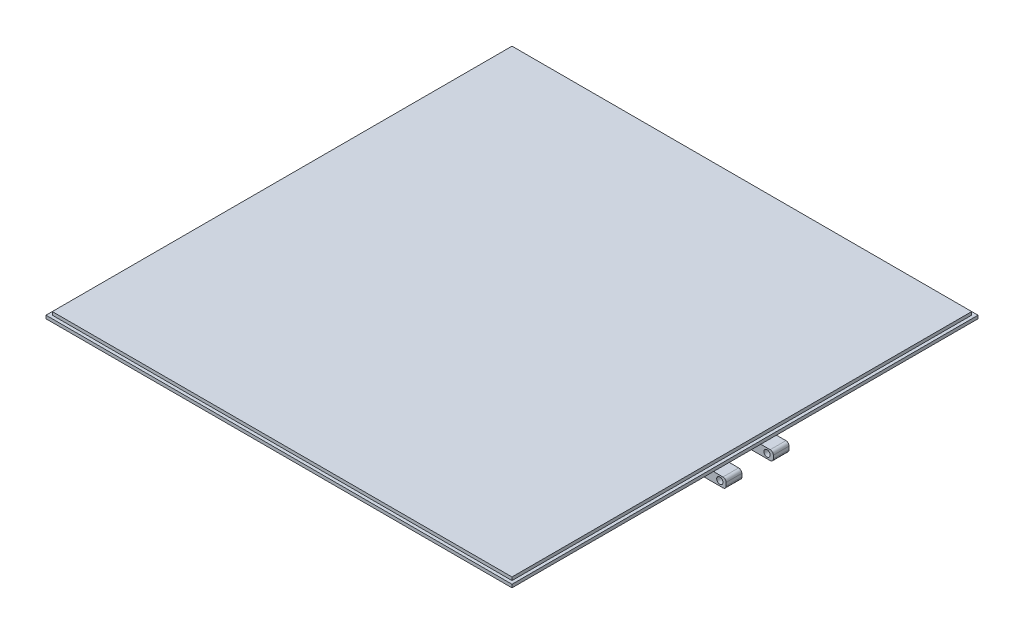
from build123d import *

# Parameters (mm, degrees)
SKETCH1_R           = 10
SKETCH1_R_2         = 7.5
BOSS_EXTRUDE1_DEPTH = 25
THREAD1_PITCH       = 0.3175
SKETCH4_W           = 146
SKETCH4_H           = 146
BOSS_EXTRUDE2_DEPTH = 2
SKETCH5_W           = 148
SKETCH5_H           = 148
BOSS_EXTRUDE3_DEPTH = 1
BOSS_EXTRUDE4_START = 7.5
SKETCH6_W           = 10
SKETCH6_H           = 3
SKETCH6_R           = 1
BOSS_EXTRUDE4_DEPTH = 2.5
BOSS_EXTRUDE5_START = -7.5
SKETCH6_2_W         = 10
SKETCH6_2_H         = 3
SKETCH6_2_R         = 1
BOSS_EXTRUDE5_DEPTH = 2.5
SKETCH9_R           = 18.995637602
CUT_EXTRUDE1_DEPTH  = 111.385687501
CHAMFER1_SIZE       = 3
FILLET1_R           = 1


with BuildPart() as part:
    # Sketch1 → Boss-Extrude1 (new body)
    with BuildSketch(Plane(origin=(0, 0, 0), x_dir=(1, 0, 0), z_dir=(0, 1, 0))):
        with Locations(Location((0, 0, 0), (0, 0, 270))):
            Circle(SKETCH1_R)
        with Locations(Location((0, 0, 0), (0, 0, 270))):
            Circle(SKETCH1_R_2, mode=Mode.SUBTRACT)
    extrude(amount=BOSS_EXTRUDE1_DEPTH)

    # Thread1: the profile of Thread Profile1 profile screwed along a right-hand helix of 18.897638 turns, 6 arcs to a turn; built about Z, then put on its axis
    thread1_z = Axis((0, 0, 0), (0, 0, 1))
    thread1_corners = [(10.0003, 0, -0.000173205), (10.0003, 0, 0.277985704), (9.828148085, 0, 0.17859375), (9.828148085, 0, 0.09921875)]
    with BuildLine(mode=Mode.PRIVATE) as thread1_profile:
        Line(thread1_corners[0], thread1_corners[1])
        Line(thread1_corners[1], thread1_corners[2])
        Line(thread1_corners[2], thread1_corners[3])
        Line(thread1_corners[3], thread1_corners[0])
    thread1_cap = Face(thread1_profile.wire())
    thread1_turn_angles = [0, 30, 60, 90, 120, 150, 180, 210, 240, 270, 300, 330, 360]
    thread1_turn_weights = [1, 0.8660254037844387, 1, 0.8660254037844387, 1, 0.8660254037844387, 1, 0.8660254037844387, 1, 0.8660254037844387, 1, 0.8660254037844387, 1]
    thread1_turn_rails = [Edge.make_bspline([Vector(p[0], p[1], 0).rotate(thread1_z, thread1_turn_angles[k]) / thread1_turn_weights[k] + Vector(0, 0, p[2] + THREAD1_PITCH * thread1_turn_angles[k] / 360) for k in range(13)], [0, 0, 0, 1, 1, 2, 2, 3, 3, 4, 4, 5, 5, 6, 6, 6], 2, thread1_turn_weights) for p in thread1_corners]
    thread1_turn_sides = [Face.make_surface_from_curves(thread1_turn_rails[p[0]], thread1_turn_rails[p[1]]) for p in [(0, 1), (1, 2), (2, 3), (3, 0)]]
    thread1_last_angles = [6480, 6510, 6540, 6570, 6600, 6630, 6660, 6690, 6720, 6750, 6780, 6791.57480315, 6803.149606299]
    thread1_last_weights = [1, 0.8660254037844387, 1, 0.8660254037844387, 1, 0.8660254037844387, 1, 0.8660254037844387, 1, 0.8660254037844387, 1, 0.9796635825089068, 1]
    thread1_last_rails = [Edge.make_bspline([Vector(p[0], p[1], 0).rotate(thread1_z, thread1_last_angles[k]) / thread1_last_weights[k] + Vector(0, 0, p[2] + THREAD1_PITCH * thread1_last_angles[k] / 360) for k in range(13)], [0, 0, 0, 1, 1, 2, 2, 3, 3, 4, 4, 5, 5, 6, 6, 6], 2, thread1_last_weights) for p in thread1_corners]
    thread1_last_sides = [Face.make_surface_from_curves(thread1_last_rails[p[0]], thread1_last_rails[p[1]]) for p in [(0, 1), (1, 2), (2, 3), (3, 0)]]
    thread1 = Plane(origin=(0, -0.5, 0), x_dir=(1, 0, 0), z_dir=(0, 1, 0)) * Solid(Shell([*[p.moved(Location((0, 0, THREAD1_PITCH * i))) for i in range(18) for p in thread1_turn_sides], *thread1_last_sides, thread1_cap, thread1_cap.rotate(thread1_z, 6803.149606299).moved(Location((0, 0, THREAD1_PITCH * 6803.149606299 / 360)))]))
    add(thread1, mode=Mode.SUBTRACT)

    # Sketch4 → Boss-Extrude2 (add)
    with BuildSketch(Plane(origin=(0, 25, 0), x_dir=(1, 0, 0), z_dir=(0, 1, 0))):
        Rectangle(SKETCH4_W, SKETCH4_H)
    extrude(amount=BOSS_EXTRUDE2_DEPTH)

    # Sketch5 → Boss-Extrude3 (add)
    with BuildSketch(Plane.XZ.offset(-25)):
        Rectangle(SKETCH5_W, SKETCH5_H)
    extrude(amount=-BOSS_EXTRUDE3_DEPTH)

    # Sketch6 → Boss-Extrude4 (add, symmetric)
    with BuildSketch(Plane.XY.offset(BOSS_EXTRUDE4_START)):
        with Locations((73, 23.5)):
            Rectangle(SKETCH6_W, SKETCH6_H)
        with Locations((76, 23.5)):
            Circle(SKETCH6_R, mode=Mode.SUBTRACT)
    extrude(amount=BOSS_EXTRUDE4_DEPTH, both=True)

    # Sketch6<2> → Boss-Extrude5 (add, symmetric)
    with BuildSketch(Plane.XY.offset(BOSS_EXTRUDE5_START)):
        with Locations((73, 23.5)):
            Rectangle(SKETCH6_2_W, SKETCH6_2_H)
        with Locations((76, 23.5)):
            Circle(SKETCH6_2_R, mode=Mode.SUBTRACT)
    extrude(amount=BOSS_EXTRUDE5_DEPTH, both=True)

    # Sketch9 → Cut-Extrude1 (cut, through all)
    with BuildSketch(Plane.XZ.offset(-25)):
        Circle(SKETCH9_R)
    extrude(amount=CUT_EXTRUDE1_DEPTH, mode=Mode.SUBTRACT)

    # Chamfer1
    chamfer1_edges = [part.edges().sort_by_distance(p)[0] for p in [
        (68, 25, -7.5),
        (68, 25, 7.5),
    ]]
    chamfer(chamfer1_edges, length=CHAMFER1_SIZE - 0.0001)  # a hair under: the kernel refuses the full size

    # Fillet1
    fillet1_edges = [part.edges().sort_by_distance(p)[0] for p in [
        (78, 22, 7.5),
        (78, 25, 7.5),
        (78, 22, -7.5),
        (78, 25, -7.5),
    ]]
    fillet(fillet1_edges, radius=FILLET1_R)


solid = part.part
